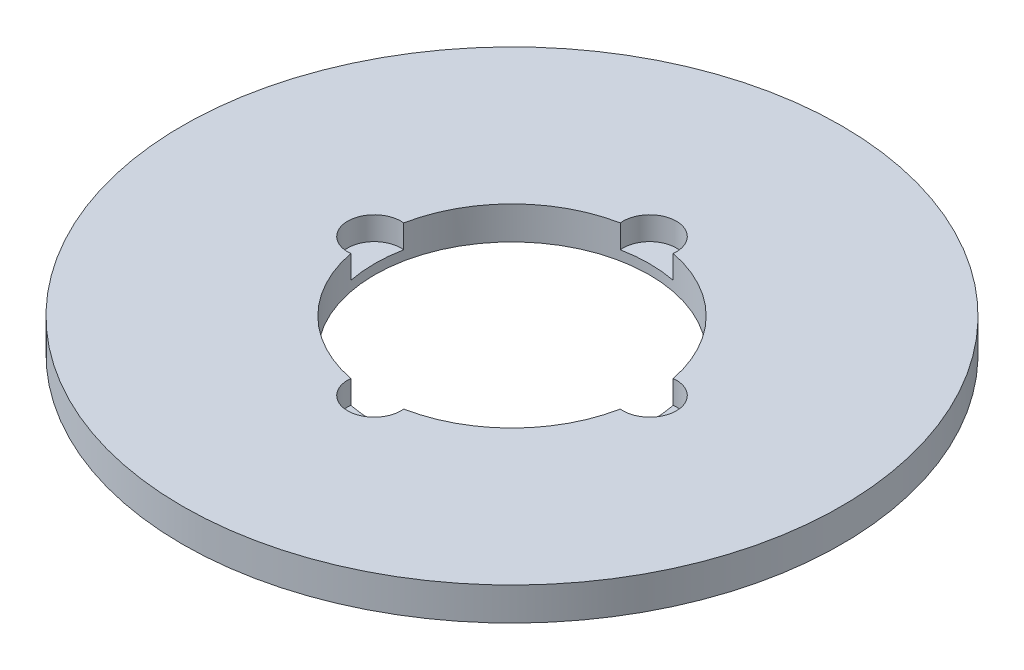
from build123d import *

# Parameters (mm, degrees)
SKETCH1_R           = 90
BOSS_EXTRUDE1_DEPTH = 9
SKETCH2_R           = 37.5
CUT_EXTRUDE1_DEPTH  = 128.597021909
SKETCH3_R           = 7.271095683
CUT_EXTRUDE2_DEPTH  = 6.356273356
CIRPATTERN1_COUNT   = 4


with BuildPart() as part:
    # Sketch1 → Boss-Extrude1 (new body)
    with BuildSketch(Plane(origin=(0, 0, 0), x_dir=(1, 0, 0), z_dir=(0, 1, 0))):
        Circle(SKETCH1_R)
    extrude(amount=BOSS_EXTRUDE1_DEPTH)

    # Sketch2 → Cut-Extrude1 (cut, through all)
    with BuildSketch(Plane(origin=(0, 0, 0), x_dir=(1, 0, 0), z_dir=(0, 1, 0))):
        Circle(SKETCH2_R)
    extrude(amount=CUT_EXTRUDE1_DEPTH, mode=Mode.SUBTRACT)

    # Sketch3 → Cut-Extrude2 (cut)
    with BuildSketch(Plane(origin=(0, 9, 0), x_dir=(1, 0, 0), z_dir=(0, 1, 0))):
        with Locations((-37.60175159, 0)):
            Circle(SKETCH3_R)
    cut_extrude2 = extrude(amount=-CUT_EXTRUDE2_DEPTH, mode=Mode.SUBTRACT)

    # CirPattern1: Cut-Extrude2 ×4 about axis
    cirpattern1_axis = Axis((0, 0, 0), (0, 1, 0))
    for i in range(1, CIRPATTERN1_COUNT):
        add(cut_extrude2.rotate(cirpattern1_axis, i * 360 / CIRPATTERN1_COUNT), mode=Mode.SUBTRACT)


solid = part.part
